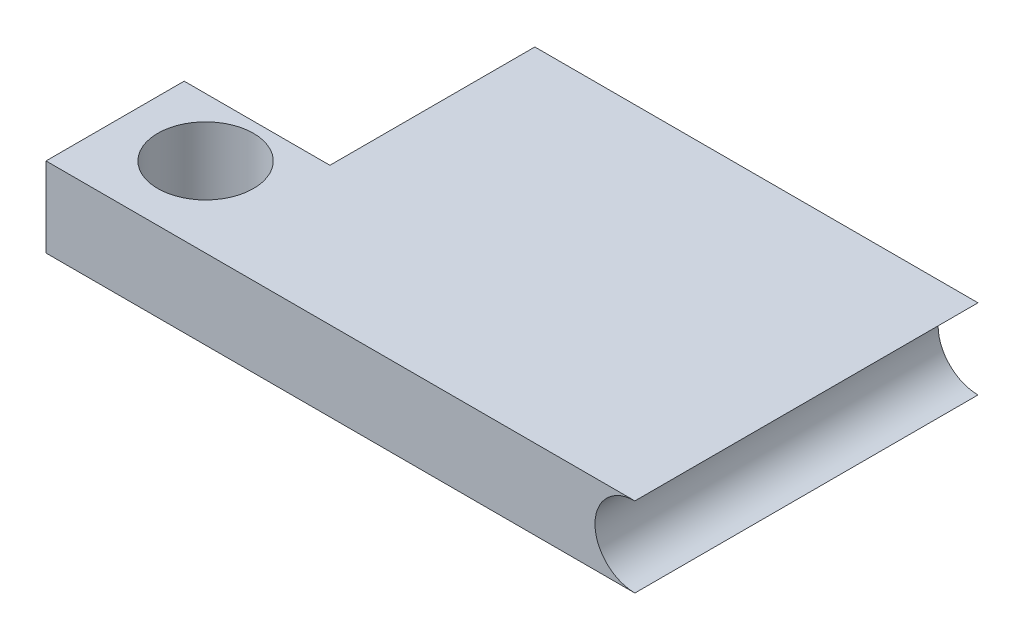
from build123d import *

# Parameters (mm, degrees)
SKETCH1_W           = 1106.97250468
SKETCH1_H           = 150
BOSS_EXTRUDE1_DEPTH = 645
SKETCH2_R           = 90
CUT_EXTRUDE1_DEPTH  = 1290.927566229
SKETCH3_W           = 273.936328983
SKETCH3_H           = 385.258703225
CUT_EXTRUDE2_DEPTH  = 1290.927566229
CUT_EXTRUDE3_DEPTH  = 1290.927566229


with BuildPart() as part:
    # Sketch1 → Boss-Extrude1 (new body)
    with BuildSketch(Plane.XY):
        with Locations((553.48625234, 75)):
            Rectangle(SKETCH1_W, SKETCH1_H)
    extrude(amount=BOSS_EXTRUDE1_DEPTH)

    # Sketch2 → Cut-Extrude1 (cut, through all)
    with BuildSketch(Plane.XZ):
        with Locations((150, 495)):
            Circle(SKETCH2_R)
    extrude(amount=-CUT_EXTRUDE1_DEPTH, mode=Mode.SUBTRACT)

    # Sketch3 → Cut-Extrude2 (cut, through all)
    with BuildSketch(Plane.XZ):
        with Locations((136.968164492, 192.629351613)):
            Rectangle(SKETCH3_W, SKETCH3_H)
    extrude(amount=-CUT_EXTRUDE2_DEPTH, mode=Mode.SUBTRACT)

    # Sketch4 → Cut-Extrude3 (cut, through all)
    with BuildSketch(Plane.XY.offset(645)):
        with BuildLine():
            Line((1106.97250468, 150), (1106.97250468, 0))
            ThreePointArc((1106.97250468, 0), (1031.97250468, 75), (1106.97250468, 150))
        make_face()
    extrude(amount=-CUT_EXTRUDE3_DEPTH, mode=Mode.SUBTRACT)


solid = part.part
